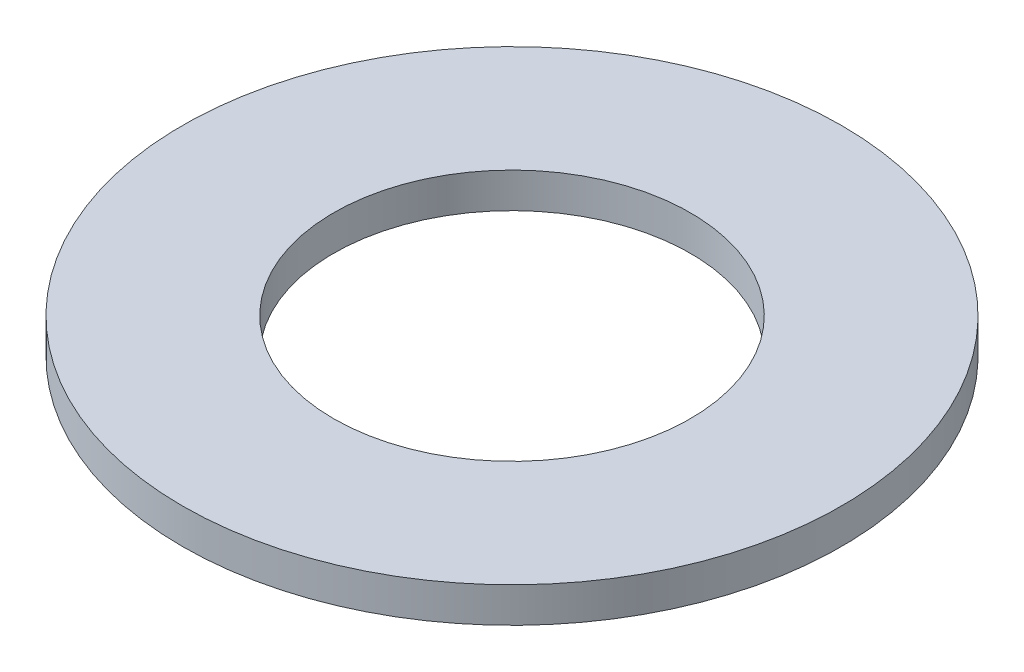
from build123d import *

# Parameters (mm, degrees)
SKETCH1_R           = 9.525
BOSS_EXTRUDE1_DEPTH = 1.016
SKETCH5_R           = 5.1562
CUT_EXTRUDE1_DEPTH  = 14.508645602


with BuildPart() as part:
    # Sketch1 → Boss-Extrude1 (new body)
    with BuildSketch(Plane(origin=(0, 0, 0), x_dir=(1, 0, 0), z_dir=(0, 1, 0))):
        Circle(SKETCH1_R)
    extrude(amount=BOSS_EXTRUDE1_DEPTH)

    # Sketch5 → Cut-Extrude1 (cut, through all)
    with BuildSketch(Plane(origin=(0, 1.016, 0), x_dir=(-1, 0, 0), z_dir=(0, 1, 0))):
        Circle(SKETCH5_R)
    extrude(amount=-CUT_EXTRUDE1_DEPTH, mode=Mode.SUBTRACT)


solid = part.part
